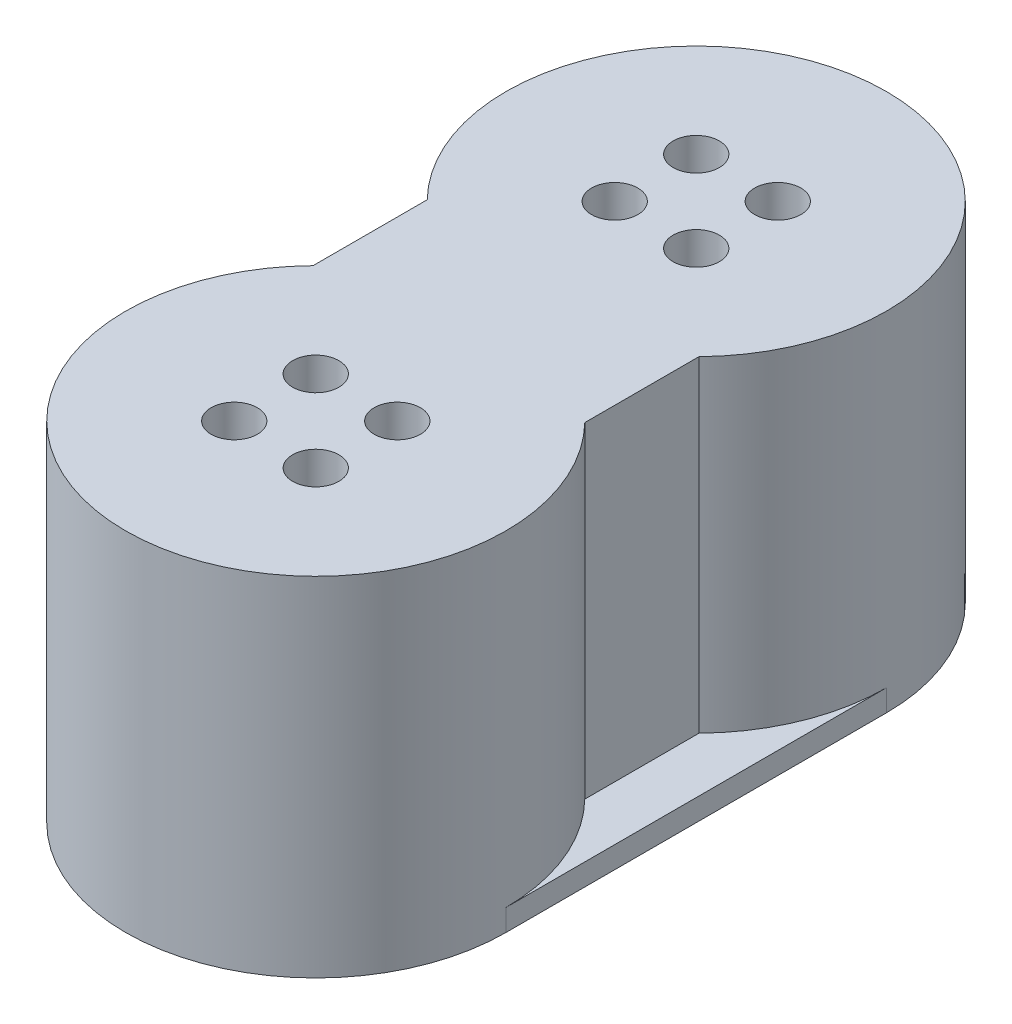
from build123d import *
from build123d.topology import SkipClean

# Parameters (mm, degrees)
EXTRUDE_1_DEPTH     = 0.8
SKETCH_2_R          = 6.4
EXTRUDE_2_DEPTH     = 4
EXTRUDE_3_DEPTH     = 8
CUT_EXTRUDE_1_REACH = 22.508
SKETCH_4_R          = 6.4
SKETCH_5_R          = 0.85
CUT_EXTRUDE_2_DEPTH = 21.508362032


# Read off the part's stored shape, not the designer's step: 填料-伸長3
with BuildPart() as part:
    # 草圖1 → 填料-伸長1 (new body)
    with BuildSketch(Plane(origin=(0, 0, 0), x_dir=(1, 0, 0), z_dir=(0, 1, 0))):
        with BuildLine():
            Line((7, 6.586363636), (7, -7.413636364))
            ThreePointArc((7, -7.413636364), (0, -14.413636364), (-7, -7.413636364))
            Line((-7, -7.413636364), (-7, 6.586363636))
            ThreePointArc((-7, 6.586363636), (0, 13.586363636), (7, 6.586363636))
        make_face()
    extrude(amount=EXTRUDE_1_DEPTH)

    # 草圖2 → 填料-伸長2 (add)
    with SkipClean():  # the faces are left unmerged after this step: merging them gives an invalid solid
        with BuildSketch(Plane(origin=(0, 0.8, 0), x_dir=(1, 0, 0), z_dir=(0, 1, 0))):
            with BuildLine():
                Line((5, -2.514656878), (5, 1.687384151))
                ThreePointArc((5, 1.687384151), (0, 13.586363636), (-5, 1.687384151))
                Line((-5, 1.687384151), (-5, -2.514656878))
                ThreePointArc((-5, -2.514656878), (0, -14.413636364), (5, -2.514656878))
            make_face()
            with Locations(Location((0, 6.586363636, 0), (0, 0, 270))):
                Circle(SKETCH_2_R, mode=Mode.SUBTRACT)
            with Locations(Location((0, -7.413636364, 0), (0, 0, 270))):
                Circle(SKETCH_2_R, mode=Mode.SUBTRACT)
        extrude(amount=EXTRUDE_2_DEPTH)

    # 填料-伸長3 outline → 填料-伸長3 (add)
    with SkipClean():  # the faces are left unmerged after this step: merging them gives an invalid solid
        with BuildSketch(Plane(origin=(0, 4.8, 0), x_dir=(1, 0, 0), z_dir=(0, 1, 0))):
            with BuildLine():
                ThreePointArc((5, 1.687384151), (0, 13.586363636), (-5, 1.687384151))
                Line((-5, 1.687384151), (-5, -2.514656878))
                ThreePointArc((-5, -2.514656878), (0, -14.413636364), (5, -2.514656878))
                Line((5, -2.514656878), (5, 1.687384151))
            make_face()
        extrude(amount=EXTRUDE_3_DEPTH)

    # 草圖4 → 除料-伸長1 (cut, up to next)
    with BuildSketch(Plane.XZ, mode=Mode.PRIVATE) as cut_extrude_1_sk1:
        with Locations(Location((0, 7.413636364, 0), (0, 0, 270))):
            Circle(SKETCH_4_R)
    cut_extrude_1_tool1 = extrude(cut_extrude_1_sk1.sketch, amount=-CUT_EXTRUDE_1_REACH, mode=Mode.PRIVATE) & part.part
    # 草圖4 → 除料-伸長1 (cut, up to next)
    with BuildSketch(Plane.XZ, mode=Mode.PRIVATE) as cut_extrude_1_sk2:
        with Locations(Location((0, -6.586363636, 0), (0, 0, 270))):
            Circle(SKETCH_4_R)
    cut_extrude_1_tool2 = extrude(cut_extrude_1_sk2.sketch, amount=-CUT_EXTRUDE_1_REACH, mode=Mode.PRIVATE) & part.part
    add(cut_extrude_1_tool1.solids().sort_by_distance((0, 0, 7.413636))[0], mode=Mode.SUBTRACT)
    add(cut_extrude_1_tool2.solids().sort_by_distance((0, 0, -6.586364))[0], mode=Mode.SUBTRACT)

    # 草圖5 → 除料-伸長2 (cut, through all)
    with SkipClean():  # the faces are left unmerged after this step: merging them gives an invalid solid
        with BuildSketch(Plane(origin=(0, 12.8, 0), x_dir=(1, 0, 0), z_dir=(0, 1, 0))):
            with Locations(Location((-1.5, 8.086363636, 0), (0, 0, 270))):
                Circle(SKETCH_5_R)
            with Locations(Location((1.5, 8.086363636, 0), (0, 0, 270))):
                Circle(SKETCH_5_R)
            with Locations(Location((1.5, 5.086363636, 0), (0, 0, 270))):
                Circle(SKETCH_5_R)
            with Locations(Location((-1.5, 5.086363636, 0), (0, 0, 270))):
                Circle(SKETCH_5_R)
            with Locations(Location((1.5, -5.913636364, 0), (0, 0, 270))):
                Circle(SKETCH_5_R)
            with Locations(Location((1.5, -8.913636364, 0), (0, 0, 270))):
                Circle(SKETCH_5_R)
            with Locations(Location((-1.5, -5.913636364, 0), (0, 0, 270))):
                Circle(SKETCH_5_R)
            with Locations(Location((-1.5, -8.913636364, 0), (0, 0, 270))):
                Circle(SKETCH_5_R)
        extrude(amount=-CUT_EXTRUDE_2_DEPTH, mode=Mode.SUBTRACT)


solid = part.part
